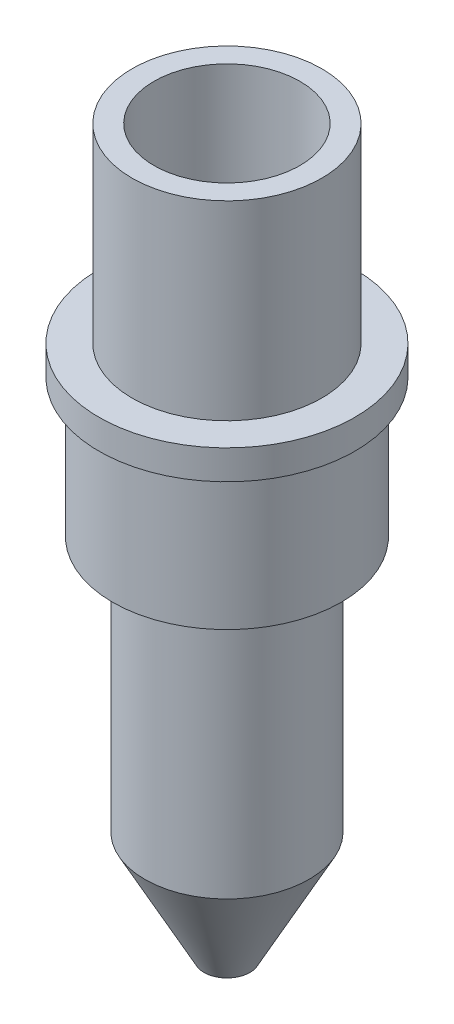
from build123d import *

# Parameters (mm, degrees)
SKETCH1_R           = 10.33
SKETCH1_R_2         = 7.95
BOSS_EXTRUDE1_DEPTH = 20.74
SKETCH2_R           = 13.94
BOSS_EXTRUDE2_DEPTH = 3.2
SKETCH3_R           = 12.44
BOSS_EXTRUDE3_DEPTH = 15
SKETCH4_R           = 8.94
BOSS_EXTRUDE4_DEPTH = 39.88
SKETCH6_R           = 2.45
CUT_EXTRUDE1_DEPTH  = 82.248012899
SKETCH7_R           = 5.5
CUT_EXTRUDE2_DEPTH  = 46


with BuildPart() as part:
    # Sketch1 → Boss-Extrude1 (new body)
    with BuildSketch(Plane(origin=(0, 0, 0), x_dir=(1, 0, 0), z_dir=(0, 1, 0))):
        Circle(SKETCH1_R)
        Circle(SKETCH1_R_2, mode=Mode.SUBTRACT)
    extrude(amount=BOSS_EXTRUDE1_DEPTH)

    # Sketch2 → Boss-Extrude2 (add)
    with BuildSketch(Plane.XZ):
        Circle(SKETCH2_R)
    extrude(amount=BOSS_EXTRUDE2_DEPTH)

    # Sketch3 → Boss-Extrude3 (add)
    with BuildSketch(Plane(origin=(0, -3.2, 0), x_dir=(-1, 0, 0), z_dir=(0, -1, 0))):
        Circle(SKETCH3_R)
    extrude(amount=BOSS_EXTRUDE3_DEPTH)

    # Sketch4 → Boss-Extrude4 (add)
    with BuildSketch(Plane(origin=(0, -18.2, 0), x_dir=(-1, 0, 0), z_dir=(0, -1, 0))):
        Circle(SKETCH4_R)
    extrude(amount=BOSS_EXTRUDE4_DEPTH)

    # Sketch5 → Cut-Revolve1 (revolve, cut)
    with BuildSketch(Plane(origin=(0, 0, 0), x_dir=(0, 0, -1), z_dir=(1, 0, 0))):
        Polygon((8.94, -46.08), (2.5, -58.08), (8.94, -58.08), align=None)
    revolve(axis=Axis((0, -58.08, 0), (0, 1, 0)), mode=Mode.SUBTRACT)

    # Sketch6 → Cut-Extrude1 (cut, through all)
    with BuildSketch(Plane.XZ.offset(58.08)):
        Circle(SKETCH6_R)
    extrude(amount=-CUT_EXTRUDE1_DEPTH, mode=Mode.SUBTRACT)

    # Sketch7 → Cut-Extrude2 (cut)
    with BuildSketch(Plane(origin=(0, 0, 0), x_dir=(1, 0, 0), z_dir=(0, 1, 0))):
        Circle(SKETCH7_R)
    extrude(amount=-CUT_EXTRUDE2_DEPTH, mode=Mode.SUBTRACT)


solid = part.part
